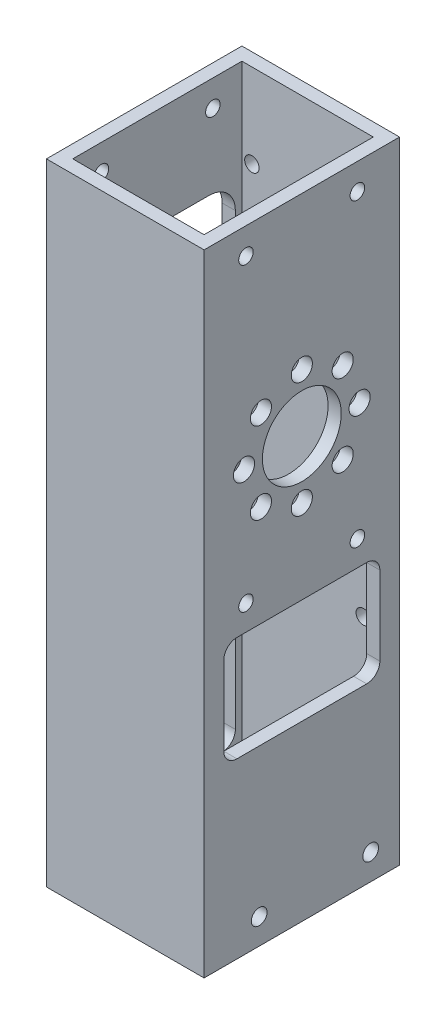
from build123d import *

# Parameters (mm, degrees)
SKETCH1_W               = 38.1
SKETCH1_H               = 47.244
SKETCH1_W_2             = 31.75
SKETCH1_H_2             = 40.894
BOSS_EXTRUDE1_DEPTH     = 152.4
CUT_EXTRUDE1_DEPTH      = 159.124996471
CUT_EXTRUDE1_DEPTH_BACK = 159.124996471
SKETCH2_R               = 1.89865
CUT_EXTRUDE3_DEPTH      = 3.175
CUT_EXTRUDE4_START      = -3.175
CUT_EXTRUDE4_DEPTH      = 3.175
SKETCH6_R               = 9.525
SKETCH6_R_2             = 2.5527
CUT_EXTRUDE5_DEPTH      = 3.175
CUT_EXTRUDE6_DEPTH      = 3.175
F_6_32_TAPPED_HOLE1_D   = 3.5052
CUT_EXTRUDE10_REACH     = 162.688
SKETCH15_R              = 1.7526


with BuildPart() as part:
    # Sketch1 → Boss-Extrude1 (new body)
    with BuildSketch(Plane(origin=(0, 0, 0), x_dir=(1, 0, 0), z_dir=(0, 1, 0))):
        Rectangle(SKETCH1_W, SKETCH1_H)
        Rectangle(SKETCH1_W_2, SKETCH1_H_2, mode=Mode.SUBTRACT)
    extrude(amount=BOSS_EXTRUDE1_DEPTH)

    # Sketch2 → Cut-Extrude1 (cut, two sides: drawn at the far end of the back side and taken through both)
    with BuildSketch(Plane.ZY.offset(-15.875).offset(-CUT_EXTRUDE1_DEPTH_BACK)):
        with Locations((-16.645384182, 6.21538)):
            Circle(SKETCH2_R)
        with Locations((10.30030417, 6.18241423)):
            Circle(SKETCH2_R)
    extrude(amount=CUT_EXTRUDE1_DEPTH + CUT_EXTRUDE1_DEPTH_BACK, mode=Mode.SUBTRACT)

    # Sketch4 → Cut-Extrude3 (cut)
    with BuildSketch(Plane.ZY.offset(19.05)):
        with BuildLine():
            Line((15.6845, 10.16), (-15.6845, 10.16))
            ThreePointArc((-15.6845, 10.16), (-17.92956403, 11.08993597), (-18.8595, 13.335))
            Line((-18.8595, 13.335), (-18.8595, 64.135))
            ThreePointArc((-18.8595, 64.135), (-17.92956403, 66.38006403), (-15.6845, 67.31))
            Line((-15.6845, 67.31), (15.6845, 67.31))
            ThreePointArc((15.6845, 67.31), (17.92956403, 66.38006403), (18.8595, 64.135))
            Line((18.8595, 64.135), (18.8595, 13.335))
            ThreePointArc((18.8595, 13.335), (17.92956403, 11.08993597), (15.6845, 10.16))
        make_face()
    extrude(amount=-CUT_EXTRUDE3_DEPTH, mode=Mode.SUBTRACT)

    # Sketch5 → Cut-Extrude4 (cut)
    with BuildSketch(Plane(origin=(19.05, 0, 0), x_dir=(0, 0, -1), z_dir=(1, 0, 0)).offset(CUT_EXTRUDE4_START)):
        with BuildLine():
            Line((15.6845, 67.31), (-15.6845, 67.31))
            ThreePointArc((-15.6845, 67.31), (-17.92956403, 66.38006403), (-18.8595, 64.135))
            Line((-18.8595, 64.135), (-18.8595, 45.085))
            ThreePointArc((-18.8595, 45.085), (-17.92956403, 42.83993597), (-15.6845, 41.91))
            Line((-15.6845, 41.91), (15.6845, 41.91))
            ThreePointArc((15.6845, 41.91), (17.92956403, 42.83993597), (18.8595, 45.085))
            Line((18.8595, 45.085), (18.8595, 64.135))
            ThreePointArc((18.8595, 64.135), (17.92956403, 66.38006403), (15.6845, 67.31))
        make_face()
    extrude(amount=CUT_EXTRUDE4_DEPTH, mode=Mode.SUBTRACT)

    # Sketch6 → Cut-Extrude5 (cut)
    with BuildSketch(Plane.ZY.offset(-15.875)):
        with Locations((0, 101.6)):
            Circle(SKETCH6_R)
        with Locations((0, 87.63)):
            Circle(SKETCH6_R_2)
        with Locations((-9.878281733, 91.721718267)):
            Circle(SKETCH6_R_2)
        with Locations((-13.97, 101.6)):
            Circle(SKETCH6_R_2)
        with Locations((-9.878281733, 111.478281733)):
            Circle(SKETCH6_R_2)
        with Locations((0, 115.57)):
            Circle(SKETCH6_R_2)
        with Locations((9.878281733, 111.478281733)):
            Circle(SKETCH6_R_2)
        with Locations((13.97, 101.6)):
            Circle(SKETCH6_R_2)
        with Locations((9.878281733, 91.721718267)):
            Circle(SKETCH6_R_2)
    extrude(amount=-CUT_EXTRUDE5_DEPTH, mode=Mode.SUBTRACT)

    # Sketch7 → Cut-Extrude6 (cut)
    with BuildSketch(Plane.ZY.offset(19.05)):
        with BuildLine():
            Line((-12.5095, 77.47), (12.5095, 77.47))
            ThreePointArc((12.5095, 77.47), (16.999628061, 79.329871939), (18.8595, 83.82))
            Line((18.8595, 83.82), (18.8595, 121.92))
            ThreePointArc((18.8595, 121.92), (16.999628061, 126.410128061), (12.5095, 128.27))
            Line((12.5095, 128.27), (-12.5095, 128.27))
            ThreePointArc((-12.5095, 128.27), (-16.999628061, 126.410128061), (-18.8595, 121.92))
            Line((-18.8595, 121.92), (-18.8595, 83.82))
            ThreePointArc((-18.8595, 83.82), (-16.999628061, 79.329871939), (-12.5095, 77.47))
        make_face()
    extrude(amount=-CUT_EXTRUDE6_DEPTH, mode=Mode.SUBTRACT)

    # #6-32 Tapped Hole1 (through all)
    with Locations(Plane(origin=(19.05, 73.406, -13.423592181), x_dir=(0, 0, 1), z_dir=(1, 0, 0))):
        with Locations((0, 0), (26.924, 0), (26.924, -72.644), (0, -72.644)):
            Hole(F_6_32_TAPPED_HOLE1_D / 2)

    # Sketch15 → Cut-Extrude10 (cut, up to next)
    with BuildSketch(Plane(origin=(0, 0, -23.622), x_dir=(-1, 0, 0), z_dir=(0, 0, -1)), mode=Mode.PRIVATE) as cut_extrude10_sk1:
        with Locations((-13.462, 50.8)):
            Circle(SKETCH15_R)
    cut_extrude10_tool1 = extrude(cut_extrude10_sk1.sketch, amount=-CUT_EXTRUDE10_REACH, mode=Mode.PRIVATE) & part.part
    # Sketch15 → Cut-Extrude10 (cut, up to next)
    with BuildSketch(Plane(origin=(0, 0, -23.622), x_dir=(-1, 0, 0), z_dir=(0, 0, -1)), mode=Mode.PRIVATE) as cut_extrude10_sk2:
        with Locations((13.462, 50.8)):
            Circle(SKETCH15_R)
    cut_extrude10_tool2 = extrude(cut_extrude10_sk2.sketch, amount=-CUT_EXTRUDE10_REACH, mode=Mode.PRIVATE) & part.part
    # Sketch15 → Cut-Extrude10 (cut, up to next)
    with BuildSketch(Plane(origin=(0, 0, -23.622), x_dir=(-1, 0, 0), z_dir=(0, 0, -1)), mode=Mode.PRIVATE) as cut_extrude10_sk3:
        with Locations((-13.462, 76.2)):
            Circle(SKETCH15_R)
    cut_extrude10_tool3 = extrude(cut_extrude10_sk3.sketch, amount=-CUT_EXTRUDE10_REACH, mode=Mode.PRIVATE) & part.part
    # Sketch15 → Cut-Extrude10 (cut, up to next)
    with BuildSketch(Plane(origin=(0, 0, -23.622), x_dir=(-1, 0, 0), z_dir=(0, 0, -1)), mode=Mode.PRIVATE) as cut_extrude10_sk4:
        with Locations((13.462, 76.2)):
            Circle(SKETCH15_R)
    cut_extrude10_tool4 = extrude(cut_extrude10_sk4.sketch, amount=-CUT_EXTRUDE10_REACH, mode=Mode.PRIVATE) & part.part
    # Sketch15 → Cut-Extrude10 (cut, up to next)
    with BuildSketch(Plane(origin=(0, 0, -23.622), x_dir=(-1, 0, 0), z_dir=(0, 0, -1)), mode=Mode.PRIVATE) as cut_extrude10_sk5:
        with Locations((-13.462, 132.08)):
            Circle(SKETCH15_R)
    cut_extrude10_tool5 = extrude(cut_extrude10_sk5.sketch, amount=-CUT_EXTRUDE10_REACH, mode=Mode.PRIVATE) & part.part
    # Sketch15 → Cut-Extrude10 (cut, up to next)
    with BuildSketch(Plane(origin=(0, 0, -23.622), x_dir=(-1, 0, 0), z_dir=(0, 0, -1)), mode=Mode.PRIVATE) as cut_extrude10_sk6:
        with Locations((13.462, 132.08)):
            Circle(SKETCH15_R)
    cut_extrude10_tool6 = extrude(cut_extrude10_sk6.sketch, amount=-CUT_EXTRUDE10_REACH, mode=Mode.PRIVATE) & part.part
    add(cut_extrude10_tool1.solids().sort_by_distance((13.462, 50.8, -23.622))[0], mode=Mode.SUBTRACT)
    add(cut_extrude10_tool2.solids().sort_by_distance((-13.462, 50.8, -23.622))[0], mode=Mode.SUBTRACT)
    add(cut_extrude10_tool3.solids().sort_by_distance((13.462, 76.2, -23.622))[0], mode=Mode.SUBTRACT)
    add(cut_extrude10_tool4.solids().sort_by_distance((-13.462, 76.2, -23.622))[0], mode=Mode.SUBTRACT)
    add(cut_extrude10_tool5.solids().sort_by_distance((13.462, 132.08, -23.622))[0], mode=Mode.SUBTRACT)
    add(cut_extrude10_tool6.solids().sort_by_distance((-13.462, 132.08, -23.622))[0], mode=Mode.SUBTRACT)


solid = part.part
